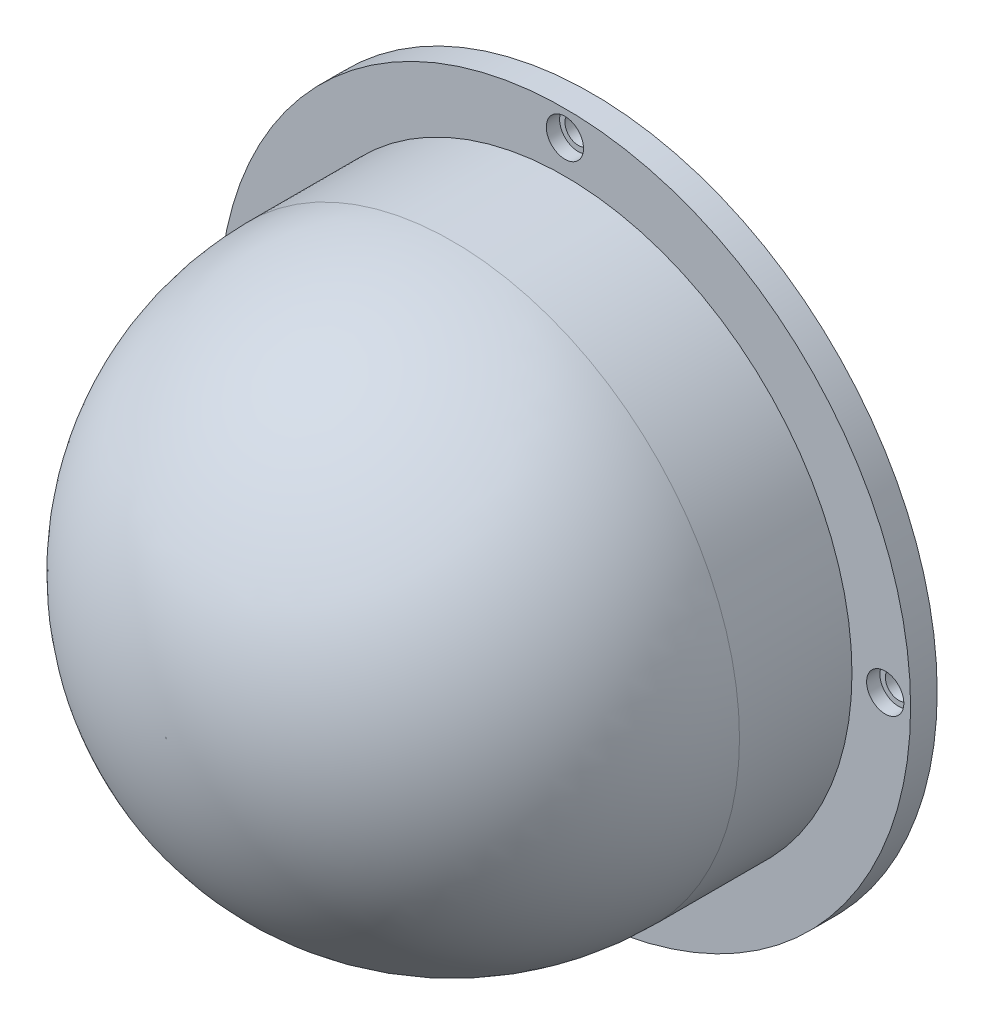
from build123d import *

# Parameters (mm, degrees)
SKETCH2_R           = 65
BOSS_EXTRUDE1_DEPTH = 5
SKETCH3_R           = 53.975
BOSS_EXTRUDE2_DEPTH = 75
FILLET7_R           = 53.848
SKETCH7_R           = 2.5
CUT_EXTRUDE2_DEPTH  = 5
SKETCH8_R           = 3.5
CUT_EXTRUDE3_DEPTH  = 2.5
CIRPATTERN1_COUNT   = 4


# Read off the part's stored shape, not the designer's step: Shell1
with BuildPart() as part:
    # Sketch2 → Boss-Extrude1 (new body)
    with BuildSketch(Plane(origin=(0, 0, 0), x_dir=(0, 1, 0), z_dir=(0, 0, 1))):
        with Locations(Location((0, 0, 0), (0, 0, 270))):
            Circle(SKETCH2_R)
    extrude(amount=BOSS_EXTRUDE1_DEPTH)

    # Sketch3 → Boss-Extrude2 (add)
    with BuildSketch(Plane.XY.offset(5)):
        Circle(SKETCH3_R)
    extrude(amount=BOSS_EXTRUDE2_DEPTH)

    # Fillet7
    fillet7_edges = [part.edges().sort_by_distance(p)[0] for p in [
        (-53.975, 0, 80),
    ]]
    fillet(fillet7_edges, radius=FILLET7_R)

    # Shell1 outline → Shell1 (revolve, cut)
    with BuildSketch(Plane.XZ):
        with BuildLine():
            Line((48.975, 0), (48.975, 26.152))
            ThreePointArc((48.975, 26.152), (34.667752047, 60.692752047), (0.127, 75))
            Line((0.127, 75), (0, 75))
            Line((0, 75), (0, 0))
            Line((0, 0), (48.975, 0))
        make_face()
    revolve(axis=Axis((0, 0, 0), (0, 0, 1)), mode=Mode.SUBTRACT)

    # Sketch7 → Cut-Extrude2 (cut)
    with BuildSketch(Plane.XY.offset(5)):
        with Locations((0, 60.247846794)):
            Circle(SKETCH7_R)
    cut_extrude2 = extrude(amount=-CUT_EXTRUDE2_DEPTH, mode=Mode.SUBTRACT)

    # Sketch8 → Cut-Extrude3 (cut)
    with BuildSketch(Plane.XY.offset(5)):
        with Locations((0, 60.223600104)):
            Circle(SKETCH8_R)
    cut_extrude3 = extrude(amount=-CUT_EXTRUDE3_DEPTH, mode=Mode.SUBTRACT)

    # CirPattern1: Cut-Extrude2, Cut-Extrude3 ×4 about axis
    cirpattern1_axis = Axis((0, 0, 0), (0, 0, 1))
    add([cut_extrude2.rotate(cirpattern1_axis, i * 360 / CIRPATTERN1_COUNT) for i in range(1, CIRPATTERN1_COUNT)], mode=Mode.SUBTRACT)
    add([cut_extrude3.rotate(cirpattern1_axis, i * 360 / CIRPATTERN1_COUNT) for i in range(1, CIRPATTERN1_COUNT)], mode=Mode.SUBTRACT)


solid = part.part
